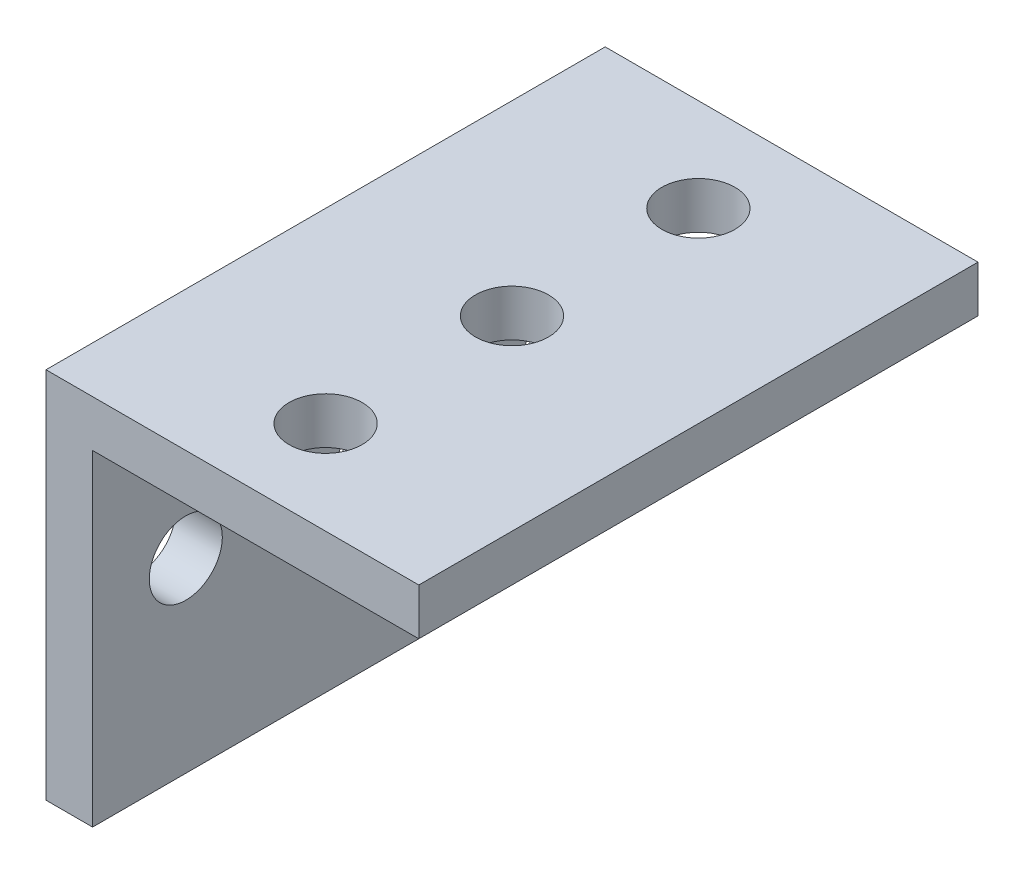
from build123d import *

# Parameters (mm, degrees)
BOSS_EXTRUDE1_DEPTH = 38.1
SKETCH5_R           = 2.4892
CUT_EXTRUDE1_DEPTH  = 51.899122045
SKETCH6_R           = 2.4892
CUT_EXTRUDE2_DEPTH  = 51.899122045


with BuildPart() as part:
    # Sketch2 → Boss-Extrude1 (new body)
    with BuildSketch(Plane.XY):
        Polygon((0, 0), (0, -25.4), (3.175, -25.4), (3.175, -3.175), (25.4, -3.175), (25.4, 0), align=None)
    extrude(amount=BOSS_EXTRUDE1_DEPTH)

    # Sketch5 → Cut-Extrude1 (cut, through all)
    with BuildSketch(Plane(origin=(3.175, 0, 0), x_dir=(0, 0, -1), z_dir=(1, 0, 0))):
        with Locations((-6.35, -12.7)):
            Circle(SKETCH5_R)
        with Locations((-19.05, -12.7)):
            Circle(SKETCH5_R)
        with Locations((-31.75, -12.7)):
            Circle(SKETCH5_R)
        with Locations((-44.45, -12.7)):
            Circle(SKETCH5_R)
    extrude(amount=-CUT_EXTRUDE1_DEPTH, mode=Mode.SUBTRACT)

    # Sketch6 → Cut-Extrude2 (cut, through all)
    with BuildSketch(Plane.XZ.offset(3.175)):
        with Locations((12.7, 6.35)):
            Circle(SKETCH6_R)
        with Locations((12.7, 19.05)):
            Circle(SKETCH6_R)
        with Locations((12.7, 31.75)):
            Circle(SKETCH6_R)
        with Locations((12.7, 44.45)):
            Circle(SKETCH6_R)
    extrude(amount=-CUT_EXTRUDE2_DEPTH, mode=Mode.SUBTRACT)


solid = part.part
